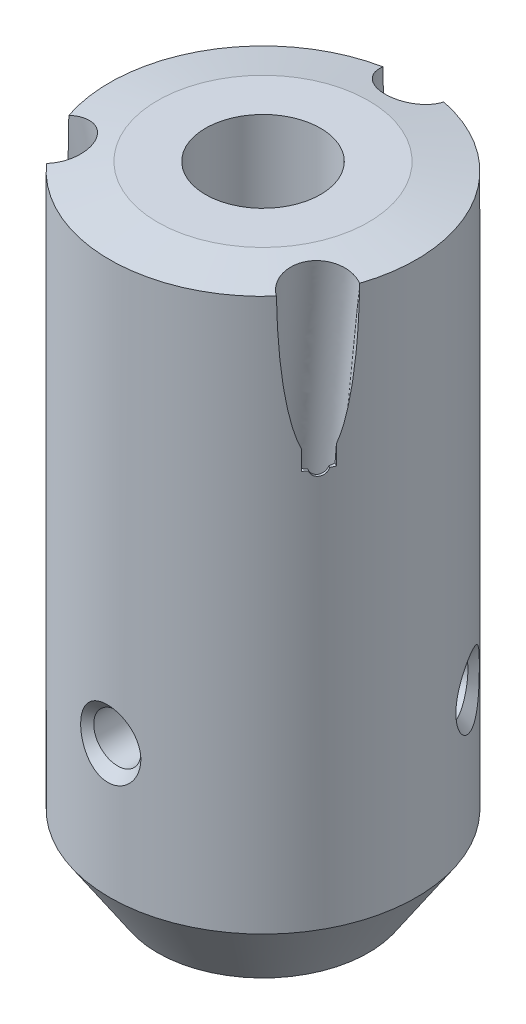
from build123d import *

# Parameters (mm, degrees)
SKETCH1_R                                           = 16
BOSS_EXTRUDE1_DEPTH                                 = 66
SKETCH2_R                                           = 6
CUT_EXTRUDE1_DEPTH                                  = 15
CUT_EXTRUDE2_START                                  = -30
SKETCH3_R                                           = 6
CUT_EXTRUDE2_DEPTH                                  = 30
CSK_FOR_M5_COUNTERSUNK_FLAT_HEAD_SCREW1_D           = 5
CSK_FOR_M5_COUNTERSUNK_FLAT_HEAD_SCREW1_DEPTH       = 8
CSK_FOR_M5_COUNTERSUNK_FLAT_HEAD_SCREW1_CSINK_D     = 7
CSK_FOR_M5_COUNTERSUNK_FLAT_HEAD_SCREW1_CSINK_ANGLE = 90
CIRPATTERN1_COUNT                                   = 3
CUT_EXTRUDE3_DEPTH                                  = 4
CIRPATTERN2_COUNT                                   = 3


with BuildPart() as part:
    # Sketch1 → Boss-Extrude1 (new body)
    with BuildSketch(Plane(origin=(0, 0, 0), x_dir=(1, 0, 0), z_dir=(0, 1, 0))):
        with Locations(Location((0, 0, 0), (0, 0, 270))):
            Circle(SKETCH1_R)
    extrude(amount=BOSS_EXTRUDE1_DEPTH)

    # Sketch2 → Cut-Extrude1 (cut)
    with BuildSketch(Plane(origin=(0, 66, 0), x_dir=(1, 0, 0), z_dir=(0, 1, 0))):
        with Locations(Location((0, 0, 0), (0, 0, 270))):
            Circle(SKETCH2_R)
    extrude(amount=-CUT_EXTRUDE1_DEPTH, mode=Mode.SUBTRACT)

    # Sketch3 → Cut-Extrude2 (cut)
    with BuildSketch(Plane.XZ.offset(CUT_EXTRUDE2_START)):
        with Locations(Location((0, 0, 0), (0, 0, 90))):
            Circle(SKETCH3_R)
    extrude(amount=CUT_EXTRUDE2_DEPTH, mode=Mode.SUBTRACT)

    # Sketch4 → Cut-Revolve1 (revolve, cut)
    with BuildSketch(Plane.XY, mode=Mode.PRIVATE) as cut_revolve1_sk:
        Polygon((-11, 66), (-16, 65.118365096), (-16, 66), align=None)
    revolve(cut_revolve1_sk.sketch.rotate(Axis((0, 66, 0), (0, -1, 0)), 270), axis=Axis((0, 66, 0), (0, -1, 0)), mode=Mode.SUBTRACT)

    # Sketch5 → Cut-Revolve2 (revolve, cut)
    with BuildSketch(Plane.XY, mode=Mode.PRIVATE) as cut_revolve2_sk:
        Polygon((-16, 7.5), (-11, 0), (-16, 0), align=None)
    revolve(cut_revolve2_sk.sketch.rotate(Axis((0, 66, 0), (0, -1, 0)), 90), axis=Axis((0, 66, 0), (0, -1, 0)), mode=Mode.SUBTRACT)

    # CSK for M5 Countersunk Flat Head Screw1
    with Locations(Plane(origin=(-0.20574428, 21.296721265, 15.998677111), x_dir=(0.999917319417, 0, 0.012859017469), z_dir=(-0.012859017469, 0, 0.999917319417))):
        with Locations((0, 0)):
            csk_for_m5_countersunk_flat_head_screw1 = CounterSinkHole(CSK_FOR_M5_COUNTERSUNK_FLAT_HEAD_SCREW1_D / 2, CSK_FOR_M5_COUNTERSUNK_FLAT_HEAD_SCREW1_CSINK_D / 2, depth=CSK_FOR_M5_COUNTERSUNK_FLAT_HEAD_SCREW1_DEPTH, counter_sink_angle=CSK_FOR_M5_COUNTERSUNK_FLAT_HEAD_SCREW1_CSINK_ANGLE)

    # CirPattern1: CSK for M5 Countersunk Flat Head Screw1 ×3 about axis
    cirpattern1_axis = Axis((0, 0, 0), (0, 1, 0))
    for i in range(1, CIRPATTERN1_COUNT):
        add(csk_for_m5_countersunk_flat_head_screw1.rotate(cirpattern1_axis, i * 360 / CIRPATTERN1_COUNT), mode=Mode.SUBTRACT)

    # Cut-Loft5: read off the stored shape, not the designer's step
    # Cut-Loft5: loft between two sections, ruled curve by curve
    cut_loft5_from = [
        Edge.make_bspline([(-2.492860085, 0, -3.256990708), (-2.413166723, 0, -3.049252367), (-2.29775661, 0, -2.823949469), (-1.952995361, 0, -2.370535926), (-1.721932172, 0, -2.141938174), (-1.269777707, 0, -1.857839001), (-1.100884873, 0, -1.773541869), (-0.734551791, 0, -1.639383798), (-0.537111544, 0, -1.589522858), (-0.121485578, 0, -1.537868182), (0.095704219, 0, -1.536048381), (0.530831789, 0, -1.587456464), (0.748582002, 0, -1.640757604), (1.164058683, 0, -1.800144328), (1.361588475, 0, -1.906154462), (1.719455924, 0, -2.158958105), (1.87970314, 0, -2.30557171), (2.15414225, 0, -2.621951741), (2.267576319, 0, -2.791071452), (2.450190005, 0, -3.135818543), (2.519369622, 0, -3.311445922), (2.665501577, 0, -3.825061977), (2.684389159, 0, -4.149546782), (2.637441595, 0, -4.717208729), (2.572553447, 0, -4.961893053), (2.413166723, 0, -5.377369734), (2.29775661, 0, -5.602672632), (1.952995361, 0, -6.056086175), (1.721932172, 0, -6.284683927), (1.269777707, 0, -6.5687831), (1.100884873, 0, -6.653080232), (0.734551791, 0, -6.787238303), (0.537111544, 0, -6.837099242), (0.121485578, 0, -6.888753919), (-0.095704219, 0, -6.89057372), (-0.530831789, 0, -6.839165637), (-0.748582002, 0, -6.785864497), (-1.164058683, 0, -6.626477773), (-1.361588475, 0, -6.520467639), (-1.719455924, 0, -6.267663996), (-1.87970314, 0, -6.121050391), (-2.15414225, 0, -5.80467036), (-2.267576319, 0, -5.635550649), (-2.450190005, 0, -5.290803558), (-2.519369622, 0, -5.115176178), (-2.665501577, 0, -4.601560124), (-2.684389159, 0, -4.277075319), (-2.637441595, 0, -3.709413371), (-2.572553447, 0, -3.464729048), (-2.492860085, 0, -3.256990708)], [0, 0, 0, 0, 0.0625, 0.0625, 0.125, 0.125, 0.15625, 0.15625, 0.1875, 0.1875, 0.21875, 0.21875, 0.25, 0.25, 0.28125, 0.28125, 0.3125, 0.3125, 0.34375, 0.34375, 0.375, 0.375, 0.4375, 0.4375, 0.5, 0.5, 0.5625, 0.5625, 0.625, 0.625, 0.65625, 0.65625, 0.6875, 0.6875, 0.71875, 0.71875, 0.75, 0.75, 0.78125, 0.78125, 0.8125, 0.8125, 0.84375, 0.84375, 0.875, 0.875, 0.9375, 0.9375, 1, 1, 1, 1], 3),
    ]
    cut_loft5_to = [
        Edge.make_bspline([(-2.862992058, 66, -17.429432221), (-2.98211141, 66, -17.19084955), (-3.087847568, 66, -16.906479919), (-3.209579228, 66, -16.234754394), (-3.224619574, 66, -15.845490939), (-3.109769682, 66, -15.215880343), (-3.048408875, 66, -14.999069896), (-2.87056074, 66, -14.56663376), (-2.753926299, 66, -14.351097002), (-2.463181911, 66, -13.941912045), (-2.288999716, 66, -13.748462702), (-1.89137268, 66, -13.405457787), (-1.668014893, 66, -13.256127294), (-1.19084955, 66, -13.01788859), (-0.937267871, 66, -12.929093156), (-0.424158499, 66, -12.817386377), (-0.164863027, 66, -12.794409362), (0.336916338, 66, -12.807903739), (0.579284697, 66, -12.844197886), (1.031806991, 66, -12.961903215), (1.241978246, 66, -13.043143367), (1.814246449, 66, -13.32969023), (2.116349465, 66, -13.57562928), (2.580113243, 66, -14.076585302), (2.743872706, 66, -14.331985107), (2.98211141, 66, -14.80915045), (3.087847568, 66, -15.093520081), (3.209579228, 66, -15.765245606), (3.224619574, 66, -16.154509061), (3.109769682, 66, -16.784119657), (3.048408875, 66, -17.000930104), (2.87056074, 66, -17.43336624), (2.753926299, 66, -17.648902998), (2.463181911, 66, -18.058087955), (2.288999716, 66, -18.251537298), (1.89137268, 66, -18.594542213), (1.668014893, 66, -18.743872706), (1.19084955, 66, -18.98211141), (0.937267871, 66, -19.070906844), (0.424158499, 66, -19.182613623), (0.164863027, 66, -19.205590638), (-0.336916338, 66, -19.192096261), (-0.579284697, 66, -19.155802114), (-1.031806991, 66, -19.038096785), (-1.241978246, 66, -18.956856633), (-1.814246449, 66, -18.67030977), (-2.116349465, 66, -18.42437072), (-2.580113243, 66, -17.923414698), (-2.743872706, 66, -17.668014893), (-2.862992058, 66, -17.429432221)], [0, 0, 0, 0, 0.0625, 0.0625, 0.125, 0.125, 0.15625, 0.15625, 0.1875, 0.1875, 0.21875, 0.21875, 0.25, 0.25, 0.28125, 0.28125, 0.3125, 0.3125, 0.34375, 0.34375, 0.375, 0.375, 0.4375, 0.4375, 0.5, 0.5, 0.5625, 0.5625, 0.625, 0.625, 0.65625, 0.65625, 0.6875, 0.6875, 0.71875, 0.71875, 0.75, 0.75, 0.78125, 0.78125, 0.8125, 0.8125, 0.84375, 0.84375, 0.875, 0.875, 0.9375, 0.9375, 1, 1, 1, 1], 3),
    ]
    cut_loft5 = Solid(Shell([*[Face.make_surface_from_curves(cut_loft5_from[k], cut_loft5_to[k]) for k in range(1)], Face(Wire(cut_loft5_from)), Face(Wire(cut_loft5_to))]))
    add(cut_loft5, mode=Mode.SUBTRACT)

    # Sketch16 → Cut-Extrude3 (cut)
    with BuildSketch(Plane.XY.offset(-16)):
        with BuildLine():
            Line((1.335, 49.118365096), (0.809419309, 49.118365096))
            ThreePointArc((0.809419309, 49.118365096), (0, 48.488463567), (-0.809419309, 49.118365096))
            Line((-0.809419309, 49.118365096), (-1.335, 49.118365096))
            Line((-1.335, 49.118365096), (-1.335, 51.982424343))
            Line((-1.335, 51.982424343), (1.335, 51.982424343))
            Line((1.335, 51.982424343), (1.335, 49.118365096))
        make_face()
    cut_extrude3 = extrude(amount=CUT_EXTRUDE3_DEPTH, mode=Mode.SUBTRACT)

    # CirPattern2: Cut-Loft5, Cut-Extrude3 ×3 about axis
    cirpattern2_axis = Axis((0, 51, 0), (0, 1, 0))
    add([cut_loft5.rotate(cirpattern2_axis, i * 360 / CIRPATTERN2_COUNT) for i in range(1, CIRPATTERN2_COUNT)], mode=Mode.SUBTRACT)
    add([cut_extrude3.rotate(cirpattern2_axis, i * 360 / CIRPATTERN2_COUNT) for i in range(1, CIRPATTERN2_COUNT)], mode=Mode.SUBTRACT)


solid = part.part
